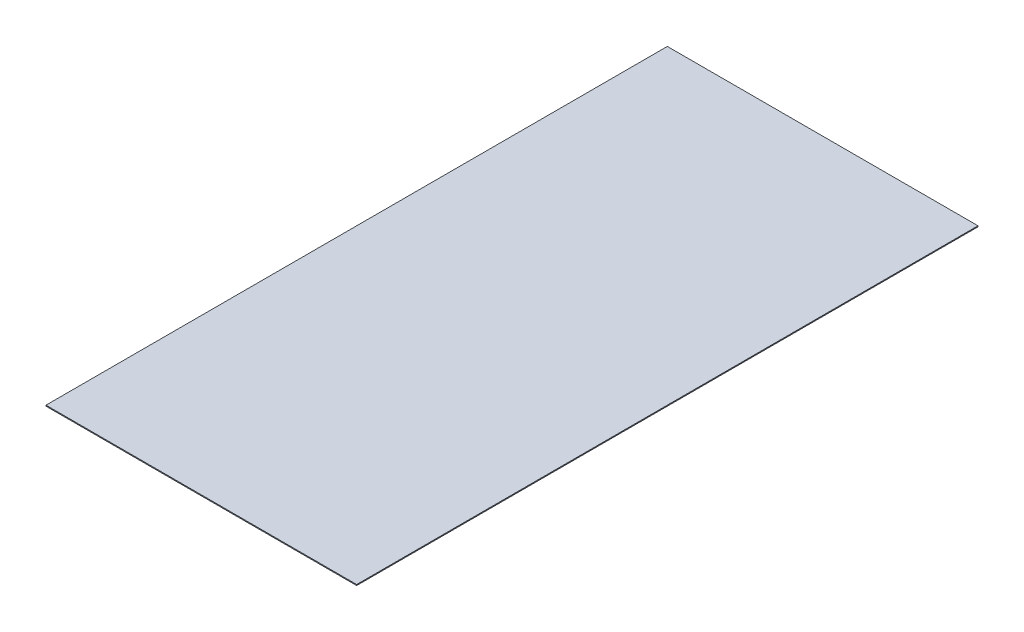
from build123d import *

# Parameters (mm, degrees)
SKETCH1_W           = 1000
SKETCH1_H           = 2000
BOSS_EXTRUDE1_DEPTH = 3


with BuildPart() as part:
    # Sketch1 → Boss-Extrude1 (new body)
    with BuildSketch(Plane(origin=(0, 0, 0), x_dir=(1, 0, 0), z_dir=(0, 1, 0))):
        Rectangle(SKETCH1_W, SKETCH1_H)
    extrude(amount=BOSS_EXTRUDE1_DEPTH)


solid = part.part
